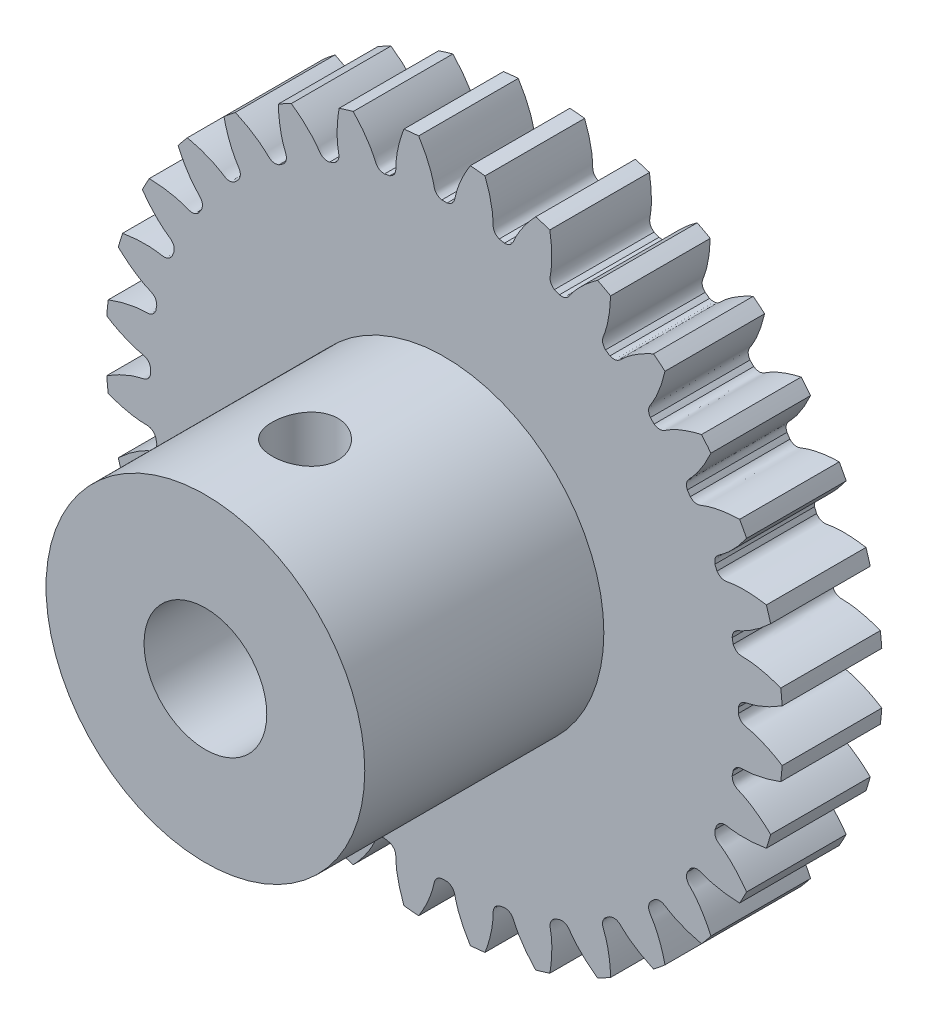
from build123d import *

# Parameters (mm, degrees)
SKETCH_1_R               = 8.5
EXTRUDE_1_DEPTH          = 2.5
CUT_EXTRUDE_1_DEPTH      = 13.278029158
PATTERN_CIRCULAR_1_COUNT = 32
SKETCH_5_R               = 4
EXTRUDE_2_DEPTH          = 6
CUT_EXTRUDE_2_REACH      = 16.694
SKETCH_4_R               = 1.54
CUT_EXTRUDE_3_REACH      = 16.694
SKETCH_6_R               = 0.825


with BuildPart() as part:
    # 草图1 → 凸台-拉伸1 (new body)
    with BuildSketch(Plane.XY):
        Circle(SKETCH_1_R)
    extrude(amount=EXTRUDE_1_DEPTH)

    # 草图2 → 切除-拉伸1 (cut, through all)
    with BuildSketch(Plane.XY):
        with BuildLine():
            ThreePointArc((0.067016057, 7.374695509), (0, 7.375), (-0.067016057, 7.374695509))
            add(Edge.make_bspline(
                [(-0.067016057, 7.374695509), (-0.244409752, 7.417585205), (-0.254185421, 7.546206625), (-0.286714327, 7.680381026), (-0.295183058, 7.71268082), (-0.305128683, 7.747692877), (-0.31664673, 7.785376713), (-0.32985255, 7.825680217), (-0.344853694, 7.868550436), (-0.361758143, 7.913930361), (-0.380671731, 7.961759942), (-0.401698795, 8.011975833), (-0.424941869, 8.064511528), (-0.450501667, 8.119297378), (-0.478476978, 8.176260642), (-0.508964584, 8.235325541), (-0.542059185, 8.296413305), (-0.577853311, 8.359442229), (-0.616437247, 8.424327727), (-0.657898954, 8.490982392), (-0.702323991, 8.559316051), (-0.749795443, 8.629235832), (-0.800393843, 8.700646224), (-0.854197106, 8.773449143), (-0.911280452, 8.847543999), (-0.971716342, 8.922827763), (-1.035574408, 8.999195043), (-1.102921392, 9.07653815), (-1.173821075, 9.154747175), (-1.248334222, 9.233710065), (-1.326518523, 9.313312698), (-1.40842851, 9.393438964), (-1.524138832, 9.502187768), (-1.614498649, 9.582084996), (-1.676516268, 9.63480345)],
                knots=[0, 0, 0, 0, 0.124532679, 0.135328735, 0.147193327, 0.160126453, 0.174128116, 0.189198313, 0.205337046, 0.222544314, 0.240820117, 0.260164456, 0.28057733, 0.302058739, 0.324608684, 0.348227164, 0.372914179, 0.39866973, 0.425493816, 0.453386438, 0.482347595, 0.512377287, 0.543475514, 0.575642277, 0.608877575, 0.643181408, 0.678553777, 0.714994681, 0.752504121, 0.791082096, 0.830728606, 0.871443651, 0.913227232, 1, 1, 1, 1], degree=3))
            ThreePointArc((-1.676516268, 9.63480345), (0, 9.779577922), (1.676516268, 9.63480345))
            add(Edge.make_bspline(
                [(0.067016057, 7.374695509), (0.244409752, 7.417585205), (0.254185421, 7.546206625), (0.286714327, 7.680381026), (0.295183058, 7.71268082), (0.305128683, 7.747692877), (0.31664673, 7.785376713), (0.32985255, 7.825680217), (0.344853694, 7.868550436), (0.361758143, 7.913930361), (0.380671731, 7.961759942), (0.401698795, 8.011975833), (0.424941869, 8.064511528), (0.450501667, 8.119297378), (0.478476978, 8.176260642), (0.508964584, 8.235325541), (0.542059185, 8.296413305), (0.577853311, 8.359442229), (0.616437247, 8.424327727), (0.657898954, 8.490982392), (0.702323991, 8.559316051), (0.749795443, 8.629235832), (0.800393843, 8.700646224), (0.854197106, 8.773449143), (0.911280452, 8.847543999), (0.971716342, 8.922827763), (1.035574408, 8.999195043), (1.102921392, 9.07653815), (1.173821075, 9.154747175), (1.248334222, 9.233710065), (1.326518523, 9.313312698), (1.40842851, 9.393438964), (1.524138832, 9.502187768), (1.614498649, 9.582084996), (1.676516268, 9.63480345)],
                knots=[0, 0, 0, 0, 0.124532679, 0.135328735, 0.147193327, 0.160126453, 0.174128116, 0.189198313, 0.205337046, 0.222544314, 0.240820117, 0.260164456, 0.28057733, 0.302058739, 0.324608684, 0.348227164, 0.372914179, 0.39866973, 0.425493816, 0.453386438, 0.482347595, 0.512377287, 0.543475514, 0.575642277, 0.608877575, 0.643181408, 0.678553777, 0.714994681, 0.752504121, 0.791082096, 0.830728606, 0.871443651, 0.913227232, 1, 1, 1, 1], degree=3))
        make_face()
    cut_extrude_1 = extrude(amount=CUT_EXTRUDE_1_DEPTH, mode=Mode.SUBTRACT)

    # 阵列(圆周)1: 切除-拉伸1 ×32 about axis
    pattern_circular_1_axis = Axis((0, 0, 2.5), (0, 0, -1))
    for i in range(1, PATTERN_CIRCULAR_1_COUNT):
        add(cut_extrude_1.rotate(pattern_circular_1_axis, i * 360 / PATTERN_CIRCULAR_1_COUNT), mode=Mode.SUBTRACT)

    # 草图5 → 凸台-拉伸2 (add)
    with BuildSketch(Plane.XY.offset(2.5)):
        Circle(SKETCH_5_R)
    extrude(amount=EXTRUDE_2_DEPTH)

    # 草图4 → 切除-拉伸2 (cut, up to next)
    with BuildSketch(Plane(origin=(0, 0, 0), x_dir=(-1, 0, 0), z_dir=(0, 0, -1)), mode=Mode.PRIVATE) as cut_extrude_2_sk1:
        Circle(SKETCH_4_R)
    cut_extrude_2_tool1 = extrude(cut_extrude_2_sk1.sketch, amount=-CUT_EXTRUDE_2_REACH, mode=Mode.PRIVATE) & part.part
    add(cut_extrude_2_tool1.solids().sort_by_distance((0, 0, 0))[0], mode=Mode.SUBTRACT)

    # 草图6 → 切除-拉伸3 (cut, up to next)
    with BuildSketch(Plane(origin=(0, 0, 0), x_dir=(1, 0, 0), z_dir=(0, 1, 0)), mode=Mode.PRIVATE) as cut_extrude_3_sk1:
        with Locations((0, -6)):
            Circle(SKETCH_6_R)
    cut_extrude_3_tool1 = extrude(cut_extrude_3_sk1.sketch, amount=CUT_EXTRUDE_3_REACH, mode=Mode.PRIVATE) & part.part
    add(cut_extrude_3_tool1.solids().sort_by_distance((0, 0, 6))[0], mode=Mode.SUBTRACT)


solid = part.part
